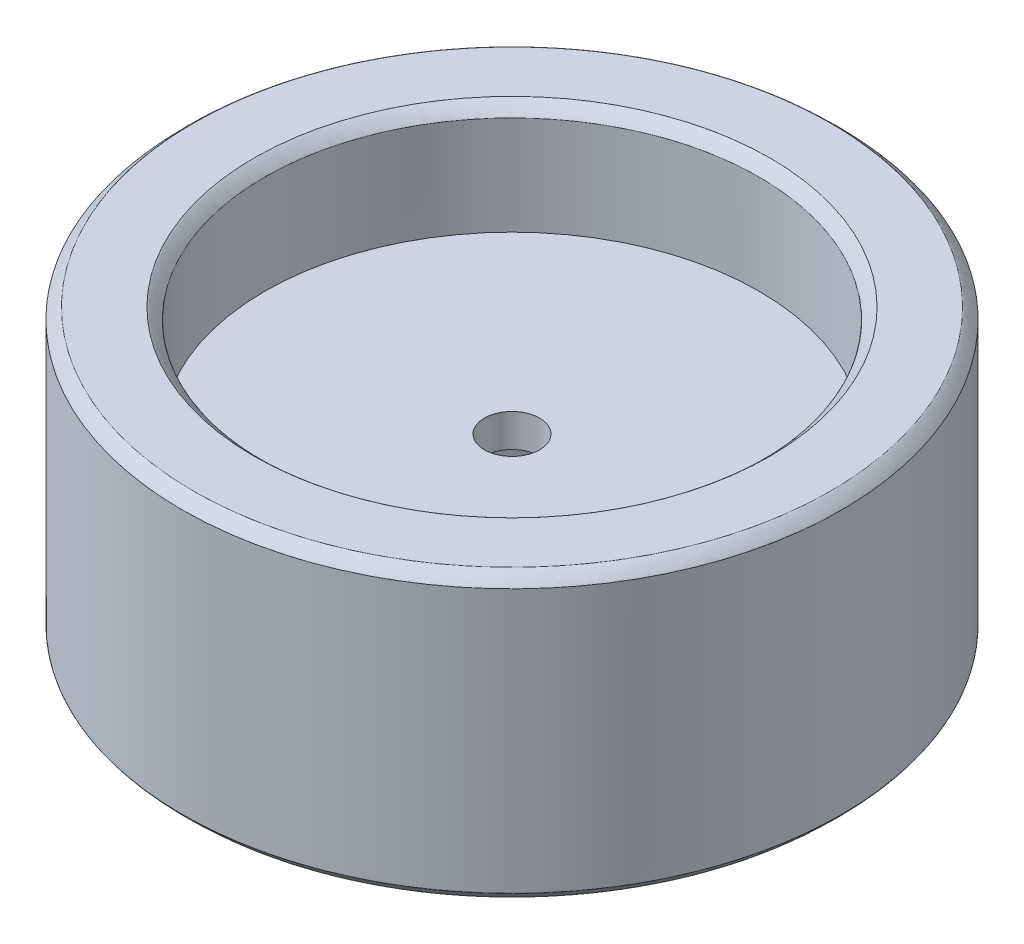
from build123d import *

# Parameters (mm, degrees)
SKETCH1_R           = 30
BOSS_EXTRUDE2_DEPTH = 26
SKETCH1_4_R         = 22.5
CUT_EXTRUDE3_DEPTH  = 13
SKETCH1_5_R         = 8
BOSS_EXTRUDE3_DEPTH = 13
SKETCH1_6_R         = 8
CUT_EXTRUDE4_DEPTH  = 9
CUT_EXTRUDE5_DEPTH  = 13
SKETCH1_8_R         = 2.51
CUT_EXTRUDE6_DEPTH  = 31
CUT_EXTRUDE7_START  = -10
SKETCH2_R           = 22.5
CUT_EXTRUDE7_DEPTH  = 10
FILLET1_SIZE        = 1


with BuildPart() as part:
    # Sketch1 → Boss-Extrude2 (new body)
    with BuildSketch(Plane(origin=(0, 0, 0), x_dir=(1, 0, 0), z_dir=(0, 1, 0))):
        with Locations(Location((0, 0, 0), (0, 0, 270))):
            Circle(SKETCH1_R)
    extrude(amount=BOSS_EXTRUDE2_DEPTH)

    # Sketch1<4> → Cut-Extrude3 (cut)
    with BuildSketch(Plane(origin=(0, 0, 0), x_dir=(1, 0, 0), z_dir=(0, 1, 0))):
        with Locations(Location((0, 0, 0), (0, 0, 90))):
            Circle(SKETCH1_4_R)
    extrude(amount=CUT_EXTRUDE3_DEPTH, mode=Mode.SUBTRACT)

    # Sketch1<5> → Boss-Extrude3 (add)
    with BuildSketch(Plane(origin=(0, 0, 0), x_dir=(1, 0, 0), z_dir=(0, 1, 0))):
        with Locations(Location((0, 0, 0), (0, 0, 90))):
            Circle(SKETCH1_5_R)
    extrude(amount=BOSS_EXTRUDE3_DEPTH)

    # Sketch1<6> → Cut-Extrude4 (cut)
    with BuildSketch(Plane(origin=(0, 0, 0), x_dir=(1, 0, 0), z_dir=(0, 1, 0))):
        with Locations(Location((0, 0, 0), (0, 0, 90))):
            Circle(SKETCH1_6_R)
    extrude(amount=CUT_EXTRUDE4_DEPTH, mode=Mode.SUBTRACT)

    # Sketch1<7> → Cut-Extrude5 (cut)
    with BuildSketch(Plane(origin=(0, 0, 0), x_dir=(1, 0, 0), z_dir=(0, 1, 0))):
        Polygon((6.92820323, 0), (3.464101615, 6), (-3.464101615, 6), (-6.92820323, 0), (-3.464101615, -6), (3.464101615, -6), align=None)
    extrude(amount=CUT_EXTRUDE5_DEPTH, mode=Mode.SUBTRACT)

    # Sketch1<8> → Cut-Extrude6 (cut)
    with BuildSketch(Plane(origin=(0, 0, 0), x_dir=(1, 0, 0), z_dir=(0, 1, 0))):
        with Locations(Location((0, 0, 0), (0, 0, 270))):
            Circle(SKETCH1_8_R)
    extrude(amount=CUT_EXTRUDE6_DEPTH, mode=Mode.SUBTRACT)

    # Sketch2 → Cut-Extrude7 (cut)
    with BuildSketch(Plane(origin=(0, 26, 0), x_dir=(1, 0, 0), z_dir=(0, 1, 0)).offset(CUT_EXTRUDE7_START)):
        with Locations(Location((0, 0, 0), (0, 0, 90))):
            Circle(SKETCH2_R)
    extrude(amount=CUT_EXTRUDE7_DEPTH, mode=Mode.SUBTRACT)

    # Fillet1
    # a fillet whose section is not a circle: 1 mm, written as the material it takes off along each edge
    with BuildSketch(Plane(origin=(0, 0, 0), x_dir=(0, 0, 1), z_dir=(-1, 0, 0))) as fillet1_piece_1:
        with BuildLine():
            Bezier((30, FILLET1_SIZE), (30, 0), (30 - FILLET1_SIZE, 0), weights=[1, 0.070710678, 1])
            Line((30 - FILLET1_SIZE, 0), (30, 0))
            Line((30, 0), (30, FILLET1_SIZE))
        make_face()
    revolve(axis=Axis((0, 0, 0), (0, 1, 0)), mode=Mode.SUBTRACT)
    with BuildSketch(Plane(origin=(0, 26, 0), x_dir=(0, 0, 1), z_dir=(-1, 0, 0))) as fillet1_piece_2:
        with BuildLine():
            Bezier((30, -FILLET1_SIZE), (30, 0), (30 - FILLET1_SIZE, 0), weights=[1, 0.070710678, 1])
            Line((30 - FILLET1_SIZE, 0), (30, 0))
            Line((30, 0), (30, -FILLET1_SIZE))
        make_face()
    revolve(axis=Axis((0, 26, 0), (0, 1, 0)), mode=Mode.SUBTRACT)
    with BuildSketch(Plane(origin=(0, 26, 0), x_dir=(0, 0, -1), z_dir=(1, 0, 0))) as fillet1_piece_3:
        with BuildLine():
            Bezier((22.5 + FILLET1_SIZE, 0), (22.5, 0), (22.5, -FILLET1_SIZE), weights=[1, 0.070710678, 1])
            Line((22.5, -FILLET1_SIZE), (22.5, 0))
            Line((22.5, 0), (22.5 + FILLET1_SIZE, 0))
        make_face()
    revolve(axis=Axis((0, 26, 0), (0, 1, 0)), mode=Mode.SUBTRACT)
    with BuildSketch(Plane(origin=(0, 0, 0), x_dir=(0, 0, -1), z_dir=(1, 0, 0))) as fillet1_piece_4:
        with BuildLine():
            Bezier((22.5 + FILLET1_SIZE, 0), (22.5, 0), (22.5, FILLET1_SIZE), weights=[1, 0.070710678, 1])
            Line((22.5, FILLET1_SIZE), (22.5, 0))
            Line((22.5, 0), (22.5 + FILLET1_SIZE, 0))
        make_face()
    revolve(axis=Axis((0, 0, 0), (0, 1, 0)), mode=Mode.SUBTRACT)


solid = part.part
